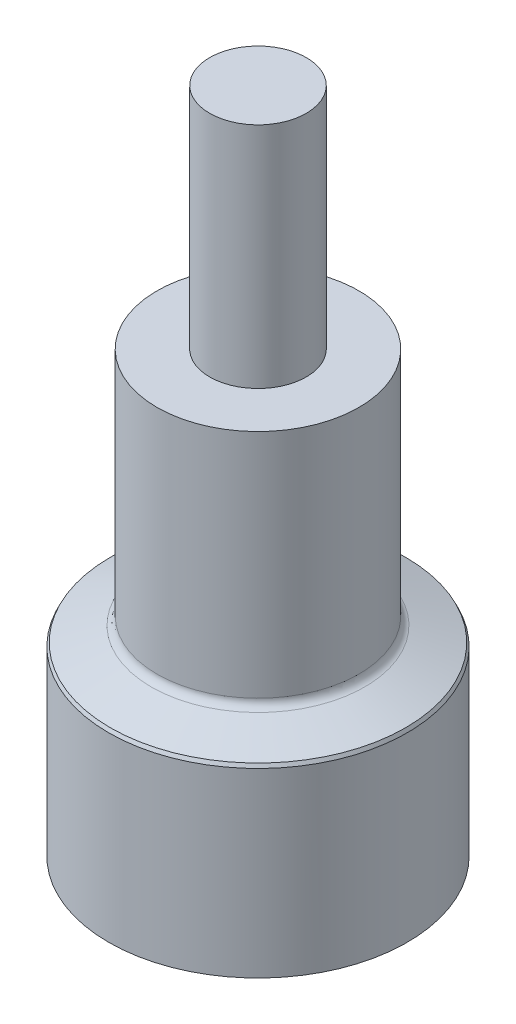
from build123d import *

# Parameters (mm, degrees)
CHAMFER_1_SIZE  = 0.2
CHAMFER_1_SIZE2 = 0.334631437
FILLET_2_R      = 1


with BuildPart() as part:
    # Эскиз2 → Повернуть2 (revolve)
    with BuildSketch(Plane.XY):
        Polygon((0, 0), (-17, 0), (-17, 21), (-11.5, 23.001836288), (-11.5, 50), (-5.5, 50), (-5.5, 76), (0, 76), align=None)
    revolve(axis=Axis((0, 76, 0), (0, -1, 0)))

    # Фаска1
    chamfer_1_edges = [part.edges().sort_by_distance(p)[0] for p in [
        (17, 21, 0),
    ]]
    chamfer_1_side = [part.faces().sort_by_distance(p)[0] for p in [
        (14.25, 22.000918144, 0),
    ]]
    chamfer(chamfer_1_edges, length=CHAMFER_1_SIZE, length2=CHAMFER_1_SIZE2, reference=chamfer_1_side[0])

    # Скругление2
    fillet_2_edges = [part.edges().sort_by_distance(p)[0] for p in [
        (11.5, 23.001836288, 0),
    ]]
    fillet(fillet_2_edges, radius=FILLET_2_R)


solid = part.part
